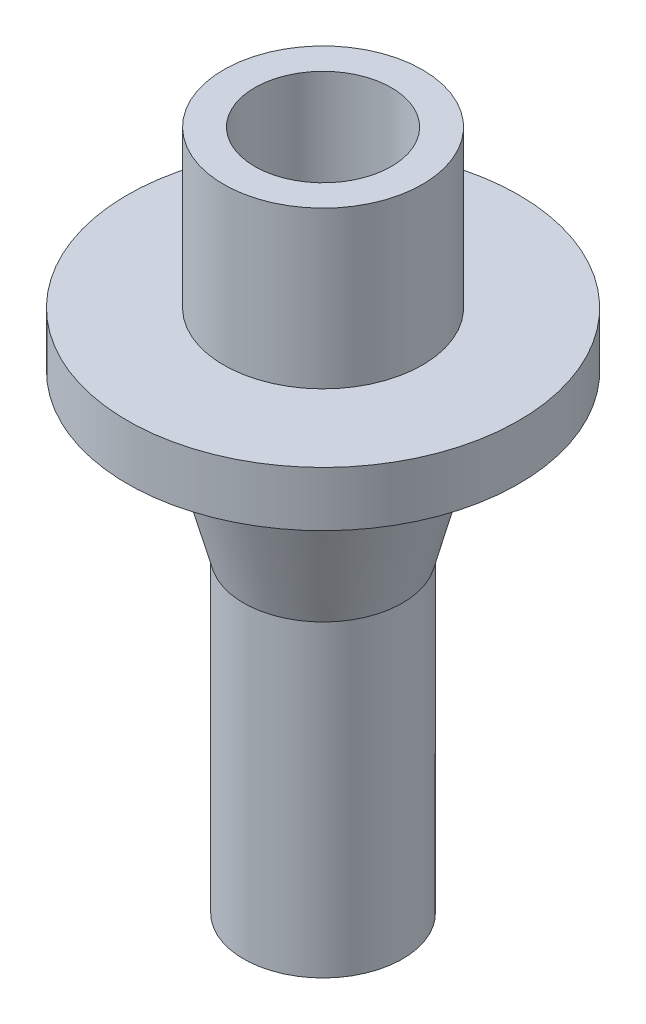
from build123d import *

# Parameters (mm, degrees)
F_3_4_16_TAPPED_HOLE1_D     = 17.4625
F_3_4_16_TAPPED_HOLE1_DEPTH = 20
F_3_4_16_TAPPED_HOLE1_TIP   = 5.24626428
CUT_EXTRUDE1_REACH          = 95.91
SKETCH5_R                   = 7.5


with BuildPart() as part:
    # Sketch1 → Revolve1 (revolve)
    with BuildSketch(Plane(origin=(0, 0, 0), x_dir=(0, 0, -1), z_dir=(1, 0, 0))):
        Polygon((0, 27), (12.7, 27), (12.7, 7), (25, 7), (25, 0), (15.68, 0), (10.16, -20.600920458), (10.16, -60), (0, -60), align=None)
    revolve(axis=Axis((0, 0, 0), (0, 1, 0)))

    # 3/4-16 Tapped Hole1
    with Locations(Plane(origin=(0, 27, 0), x_dir=(1, 0, 0), z_dir=(0, 1, 0))):
        with Locations((0, 0)):
            Hole(F_3_4_16_TAPPED_HOLE1_D / 2, depth=F_3_4_16_TAPPED_HOLE1_DEPTH)
            with Locations((0, 0, -(F_3_4_16_TAPPED_HOLE1_DEPTH + F_3_4_16_TAPPED_HOLE1_TIP / 2))):  # 118° drill point
                Cone(0, F_3_4_16_TAPPED_HOLE1_D / 2, F_3_4_16_TAPPED_HOLE1_TIP, mode=Mode.SUBTRACT)

    # Sketch5 → Cut-Extrude1 (cut, up to next)
    with BuildSketch(Plane.XZ.offset(60), mode=Mode.PRIVATE) as cut_extrude1_sk1:
        Circle(SKETCH5_R)
    cut_extrude1_tool1 = extrude(cut_extrude1_sk1.sketch, amount=-CUT_EXTRUDE1_REACH, mode=Mode.PRIVATE) & part.part
    add(cut_extrude1_tool1.solids().sort_by_distance((0, -60, 0))[0], mode=Mode.SUBTRACT)


solid = part.part
